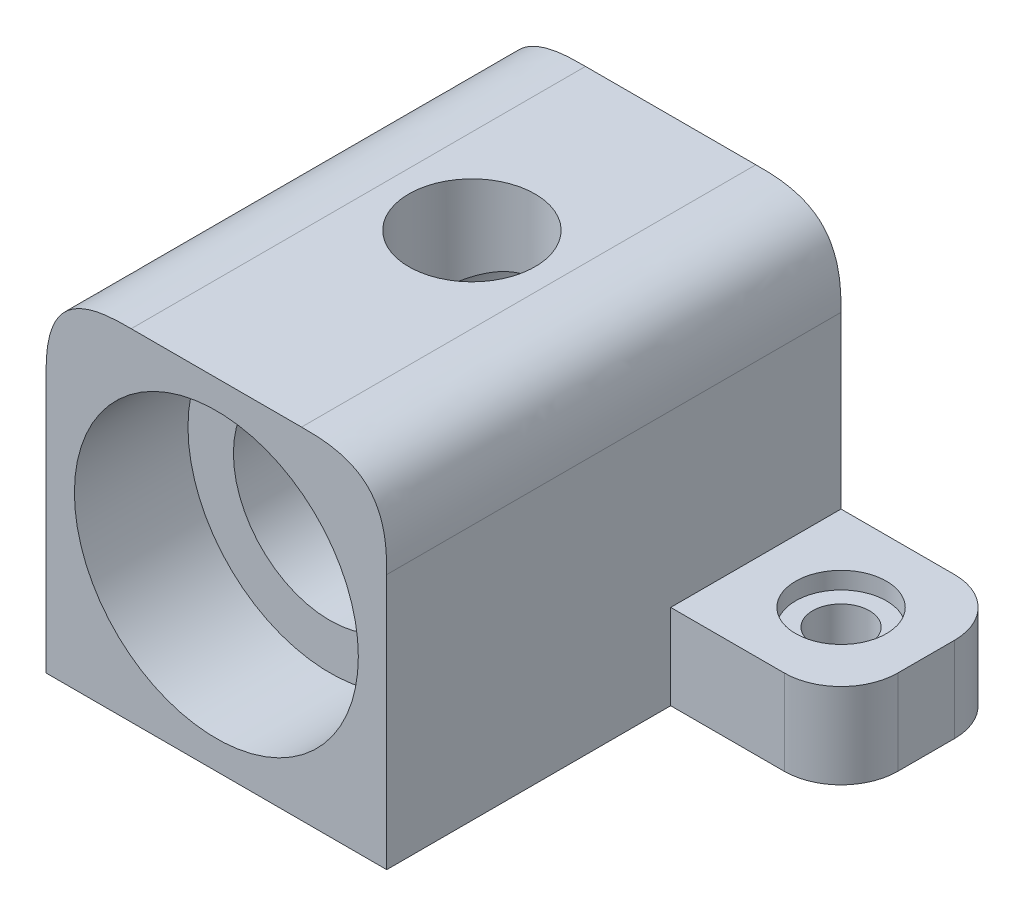
from build123d import *

# Parameters (mm, degrees)
BOSS_EXTRUDE1_DEPTH      = 35
BOSS_EXTRUDE1_DEPTH_BACK = 5
SKETCH1_W                = 30
SKETCH1_H                = 30
FILLET1_SIZE             = 7.5
SKETCH2_R                = 8.5
CUT_EXTRUDE1_DEPTH       = 60
SKETCH3_W                = 15
SKETCH3_H                = 7.5
BOSS_EXTRUDE2_DEPTH      = 15
SKETCH5_W                = 15
SKETCH5_H                = 7.5
BOSS_EXTRUDE4_DEPTH      = 15
SKETCH11_R               = 12.5
CUT_EXTRUDE3_DEPTH       = 10
FILLET8_R                = 5
SKETCH15_R               = 4
CUT_EXTRUDE5_DEPTH       = 1.5
SKETCH19_R               = 5.55625
CUT_EXTRUDE10_DEPTH      = 11.5
SKETCH21_R               = 2.5
CUT_EXTRUDE11_DEPTH      = 11.5


with BuildPart() as part:
    # Sketch1 → Boss-Extrude1 (new, two sides: drawn at the far end of the back side and taken through both)
    with BuildSketch(Plane.XY.offset(-BOSS_EXTRUDE1_DEPTH_BACK)):
        Rectangle(SKETCH1_W, SKETCH1_H)
    extrude(amount=BOSS_EXTRUDE1_DEPTH + BOSS_EXTRUDE1_DEPTH_BACK)

    # Fillet1
    # a fillet whose section is not a circle: 7.5 mm, written as the material it takes off along each edge
    with BuildSketch(Plane(origin=(-15, 15, 53.75), x_dir=(1, 0, 0), z_dir=(0, 0, -1))) as fillet1_piece_1:
        with BuildLine():
            add(Edge.make_bspline([(FILLET1_SIZE, 0), (FILLET1_SIZE * 0.831801948466, 0), (FILLET1_SIZE * 0.663603896932, 0), (FILLET1_SIZE * 0.292893218813, FILLET1_SIZE * 0.0716919198361), (FILLET1_SIZE * 0.0716919198361, FILLET1_SIZE * 0.292893218813), (0, FILLET1_SIZE * 0.663603896932), (0, FILLET1_SIZE * 0.831801948466), (0, FILLET1_SIZE)], knots=[0, 0, 0, 0, 0, 0, 0.5, 0.5, 1, 1, 1, 1, 1, 1], degree=5))
            Line((0, FILLET1_SIZE), (0, 0))
            Line((0, 0), (FILLET1_SIZE, 0))
        make_face()
    extrude(amount=77.5, mode=Mode.SUBTRACT)
    with BuildSketch(Plane(origin=(15, 15, -23.75), x_dir=(0, -1, 0), z_dir=(0, 0, 1))) as fillet1_piece_2:
        with BuildLine():
            add(Edge.make_bspline([(FILLET1_SIZE, 0), (FILLET1_SIZE * 0.831801948466, 0), (FILLET1_SIZE * 0.663603896932, 0), (FILLET1_SIZE * 0.292893218813, -FILLET1_SIZE * 0.0716919198361), (FILLET1_SIZE * 0.0716919198361, -FILLET1_SIZE * 0.292893218813), (0, -FILLET1_SIZE * 0.663603896932), (0, -FILLET1_SIZE * 0.831801948466), (0, -FILLET1_SIZE)], knots=[0, 0, 0, 0, 0, 0, 0.5, 0.5, 1, 1, 1, 1, 1, 1], degree=5))
            Line((0, -FILLET1_SIZE), (0, 0))
            Line((0, 0), (FILLET1_SIZE, 0))
        make_face()
    extrude(amount=77.5, mode=Mode.SUBTRACT)

    # Sketch2 → Cut-Extrude1 (cut)
    with BuildSketch(Plane.XY):
        with Locations(Location((0, 0, 0), (0, 0, 180))):
            Circle(SKETCH2_R)
    extrude(amount=CUT_EXTRUDE1_DEPTH, mode=Mode.SUBTRACT)

    # Sketch3 → Boss-Extrude2 (add)
    with BuildSketch(Plane(origin=(15, 0, 0), x_dir=(0, 0, -1), z_dir=(1, 0, 0))):
        with Locations((-2.5, -11.25)):
            Rectangle(SKETCH3_W, SKETCH3_H)
    extrude(amount=BOSS_EXTRUDE2_DEPTH)

    # Sketch5 → Boss-Extrude4 (add)
    with BuildSketch(Plane.ZY.offset(15)):
        with Locations((2.5, -11.25)):
            Rectangle(SKETCH5_W, SKETCH5_H)
    extrude(amount=BOSS_EXTRUDE4_DEPTH)

    # Sketch11 → Cut-Extrude3 (cut)
    with BuildSketch(Plane.XY.offset(35)):
        Circle(SKETCH11_R)
    extrude(amount=-CUT_EXTRUDE3_DEPTH, mode=Mode.SUBTRACT)

    # Fillet8
    fillet8_edges = [part.edges().sort_by_distance(p)[0] for p in [
        (30, -11.25, -5),
        (30, -11.25, 10),
        (-30, -11.25, -5),
        (-30, -11.25, 10),
    ]]
    fillet(fillet8_edges, radius=FILLET8_R)

    # Sketch15 → Cut-Extrude5 (cut)
    with BuildSketch(Plane(origin=(0, -7.5, 0), x_dir=(1, 0, 0), z_dir=(0, 1, 0))):
        with Locations(Location((22.5, -2.5, 0), (0, 0, 270))):
            Circle(SKETCH15_R)
        with Locations(Location((-22.5, -2.5, 0), (0, 0, 270))):
            Circle(SKETCH15_R)
    extrude(amount=-CUT_EXTRUDE5_DEPTH, mode=Mode.SUBTRACT)

    # Sketch19 → Cut-Extrude10 (cut)
    with BuildSketch(Plane(origin=(0, 15, 0), x_dir=(1, 0, 0), z_dir=(0, 1, 0))):
        with Locations(Location((0, -12.5, 0), (0, 0, 180))):
            Circle(SKETCH19_R)
    extrude(amount=-CUT_EXTRUDE10_DEPTH, mode=Mode.SUBTRACT)

    # Sketch21 → Cut-Extrude11 (cut)
    with BuildSketch(Plane(origin=(0, -9, 0), x_dir=(1, 0, 0), z_dir=(0, 1, 0))):
        with Locations(Location((-22.5, -2.5, 0), (0, 0, 270))):
            Circle(SKETCH21_R)
        with Locations(Location((22.5, -2.5, 0), (0, 0, 270))):
            Circle(SKETCH21_R)
    extrude(amount=-CUT_EXTRUDE11_DEPTH, mode=Mode.SUBTRACT)


solid = part.part
